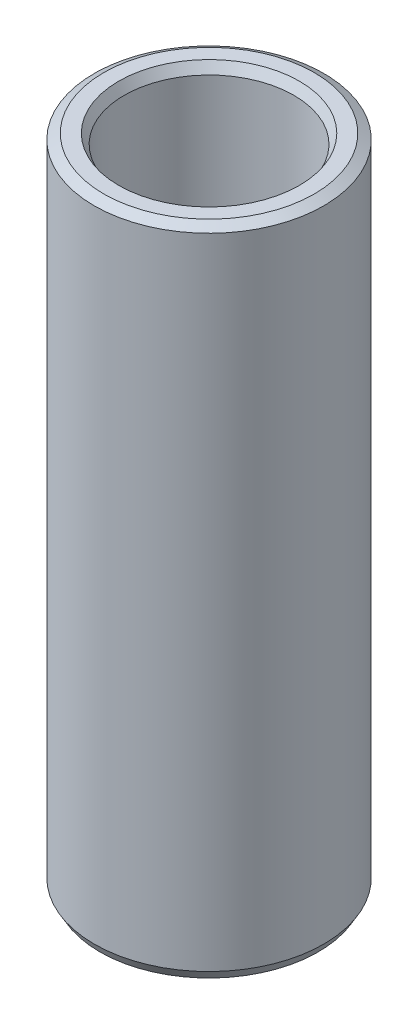
from build123d import *
from OCP.BRepFilletAPI import BRepFilletAPI_MakeChamfer

# Parameters (mm, degrees)
SKETCH1_R           = 50
BOSS_EXTRUDE1_DEPTH = 285.169158643
SKETCH2_R           = 36.973908803
CUT_EXTRUDE1_DEPTH  = 294.805120856
CHAMFER1_SIZE       = 2.393244745
CHAMFER1_SIZE2      = 4.145221493


with BuildPart() as part:
    # Sketch1 → Boss-Extrude1 (new body)
    with BuildSketch(Plane(origin=(0, 0, 0), x_dir=(1, 0, 0), z_dir=(0, 1, 0))):
        Circle(SKETCH1_R)
    extrude(amount=BOSS_EXTRUDE1_DEPTH)

    # Sketch2 → Cut-Extrude1 (cut, through all)
    with BuildSketch(Plane(origin=(0, 0, 0), x_dir=(1, 0, 0), z_dir=(0, 1, 0))):
        Circle(SKETCH2_R)
    extrude(amount=CUT_EXTRUDE1_DEPTH, mode=Mode.SUBTRACT)

    # Chamfer1: one chamfer whose edges measure the first distance from different faces: ONE call of the kernel's chamfer builder (chamfer() names one face for all edges)
    chamfer1_edges_1 = [part.edges().sort_by_distance(p)[0] for p in [
        (-36.973908803, 285.169158643, 0),
    ]]
    chamfer1_side_1 = [part.faces().sort_by_distance(p)[0] for p in [
        (-48.585786438, 285.169158643, 0),
    ]]
    chamfer1_edges_2 = [part.edges().sort_by_distance(p)[0] for p in [
        (-36.973908803, 0, 0),
    ]]
    chamfer1_side_2 = [part.faces().sort_by_distance(p)[0] for p in [
        (-36.973908803, 142.584579322, 0),
    ]]
    chamfer1_edges_3 = [part.edges().sort_by_distance(p)[0] for p in [
        (-50, 0, 0),
    ]]
    chamfer1_side_3 = [part.faces().sort_by_distance(p)[0] for p in [
        (-48.585786438, 0, 0),
    ]]
    chamfer1_edges_4 = [part.edges().sort_by_distance(p)[0] for p in [
        (-50, 285.169158643, 0),
    ]]
    chamfer1_side_4 = [part.faces().sort_by_distance(p)[0] for p in [
        (-50, 142.584579322, 0),
    ]]
    chamfer1 = BRepFilletAPI_MakeChamfer(part.part.solid().wrapped)
    for e in chamfer1_edges_1:
        chamfer1.Add(CHAMFER1_SIZE, CHAMFER1_SIZE2, e.wrapped, chamfer1_side_1[0].wrapped)  # the first distance lies on this face
    for e in chamfer1_edges_2:
        chamfer1.Add(CHAMFER1_SIZE, CHAMFER1_SIZE2, e.wrapped, chamfer1_side_2[0].wrapped)  # the first distance lies on this face
    for e in chamfer1_edges_3:
        chamfer1.Add(CHAMFER1_SIZE, CHAMFER1_SIZE2, e.wrapped, chamfer1_side_3[0].wrapped)  # the first distance lies on this face
    for e in chamfer1_edges_4:
        chamfer1.Add(CHAMFER1_SIZE, CHAMFER1_SIZE2, e.wrapped, chamfer1_side_4[0].wrapped)  # the first distance lies on this face
    add(Compound.cast(chamfer1.Shape()), mode=Mode.REPLACE)


solid = part.part
